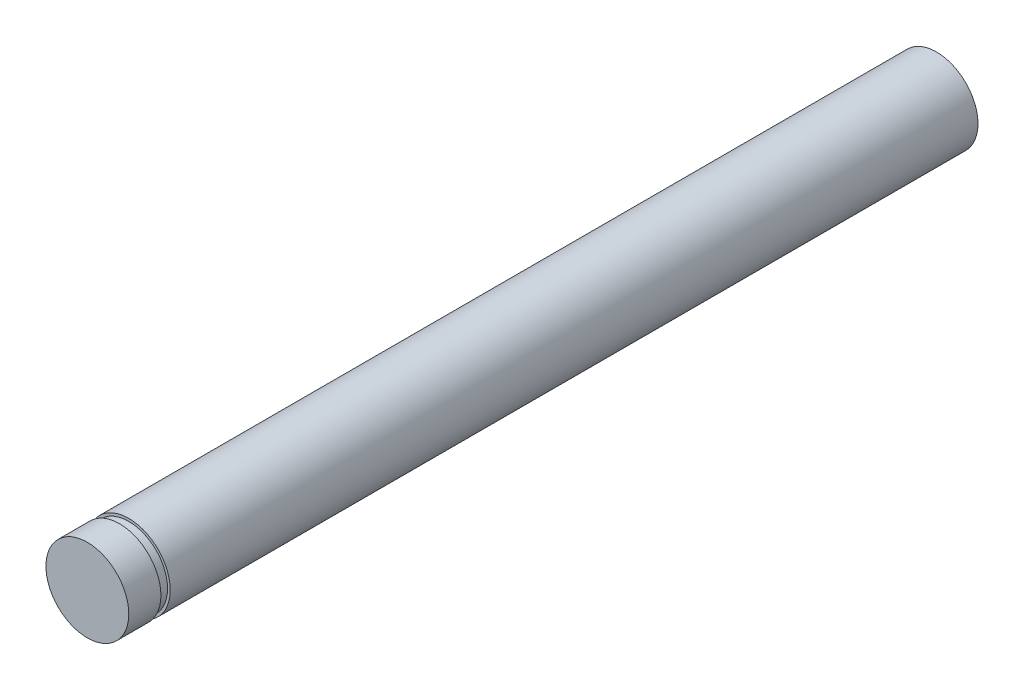
from build123d import *

# Parameters (mm, degrees)
BOSS_EXTRUDE1_START         = -123.825
BOSS_EXTRUDE1_OUTLINE_R     = 6.35
BOSS_EXTRUDE1_DEPTH         = 130.175
SKETCH5_W                   = 1.4224
SKETCH5_H                   = 0.4064
F_1_4_20_TAPPED_HOLE1_D     = 5.1054
F_1_4_20_TAPPED_HOLE1_DEPTH = 16.51
F_1_4_20_TAPPED_HOLE1_TIP   = 1.533816902


# Read off the part's stored shape, not the designer's step: Boss-Extrude1
with BuildPart() as part:
    # Boss-Extrude1 outline → Boss-Extrude1 (new body)
    with BuildSketch(Plane.XY.offset(BOSS_EXTRUDE1_START)):
        Circle(BOSS_EXTRUDE1_OUTLINE_R)
    extrude(amount=BOSS_EXTRUDE1_DEPTH)

    # Sketch5 → Cut-Revolve1 (revolve, cut)
    with BuildSketch(Plane(origin=(0, 0, 0), x_dir=(0, 0, -1), z_dir=(1, 0, 0)), mode=Mode.PRIVATE) as cut_revolve1_sk:
        with Locations((-0.7112, -6.1468)):
            Rectangle(SKETCH5_W, SKETCH5_H)
    revolve(cut_revolve1_sk.sketch.rotate(Axis((0, 0, 0), (0, 0, -1)), 270), axis=Axis((0, 0, 0), (0, 0, -1)), mode=Mode.SUBTRACT)

    # 1/4-20 Tapped Hole1
    with Locations(Plane(origin=(0, 0, -123.825), x_dir=(-1, 0, 0), z_dir=(0, 0, -1))):
        with Locations((0, 0)):
            Hole(F_1_4_20_TAPPED_HOLE1_D / 2, depth=F_1_4_20_TAPPED_HOLE1_DEPTH)
            with Locations((0, 0, -(F_1_4_20_TAPPED_HOLE1_DEPTH + F_1_4_20_TAPPED_HOLE1_TIP / 2))):  # 118° drill point
                Cone(0, F_1_4_20_TAPPED_HOLE1_D / 2, F_1_4_20_TAPPED_HOLE1_TIP, mode=Mode.SUBTRACT)


solid = part.part
